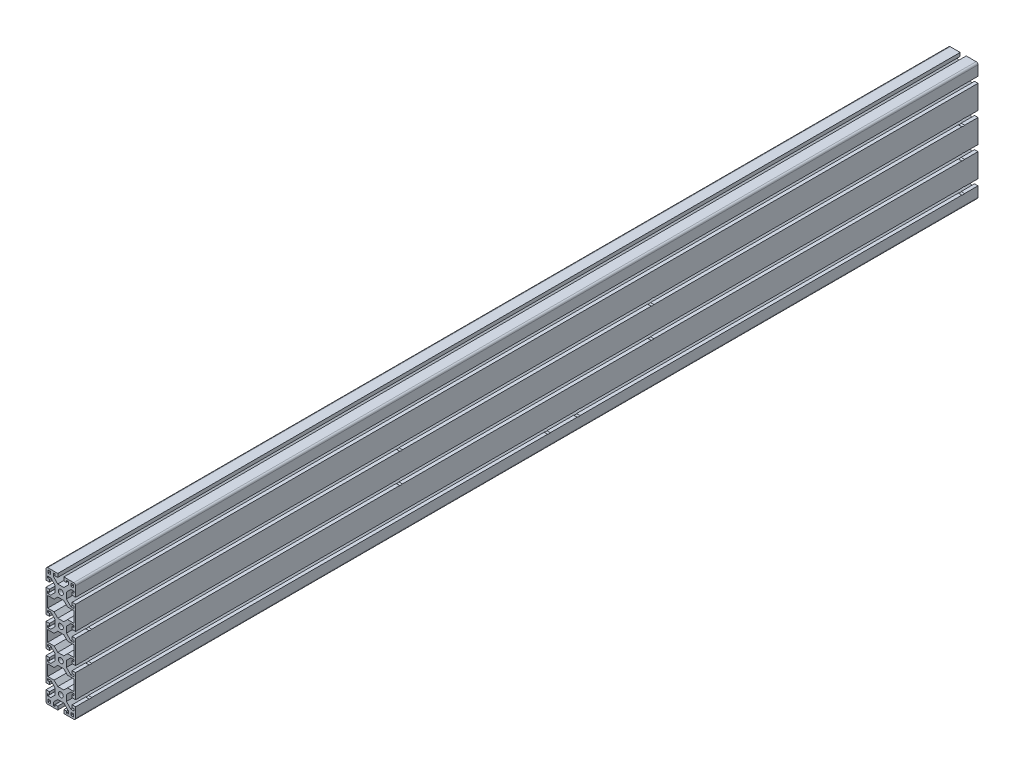
from build123d import *

# Parameters (mm, degrees)
SKETCH2_R                      = 3.35
SKETCH2_W                      = 3.788885221
SKETCH2_H                      = 3.788885221
F_40_SERIES_TS40_160LM_1_DEPTH = 1219.999999924
M8_CLEARANCE_HOLE1_D           = 9
M8_CLEARANCE_HOLE2_D           = 9
M8X1_25_TAPPED_HOLE2_D         = 6.8
M8X1_25_TAPPED_HOLE2_DEPTH     = 23.75
M8X1_25_TAPPED_HOLE2_TIP       = 2.042926105
M8X1_25_TAPPED_HOLE3_D         = 6.8
M8X1_25_TAPPED_HOLE3_DEPTH     = 23.75
M8X1_25_TAPPED_HOLE3_TIP       = 2.042926105


with BuildPart() as part:
    # Sketch2 → 40 series TS40-160LM(1) (new body)
    with BuildSketch(Plane.XY.offset(-609.999999962)):
        with BuildLine():
            Line((20, -15.9), (20, 15.9))
            Line((20, 15.9), (15.3, 15.9))
            Line((15.3, 15.9), (15.3, 12.4))
            Line((15.3, 12.4), (17.65, 12.4))
            Line((17.65, 12.4), (17.65, 9.9))
            Line((17.65, 9.9), (13.6, 9.9))
            Line((13.6, 9.9), (7.6, 15.9))
            Line((7.6, 15.9), (7.6, 24.1))
            Line((7.6, 24.1), (13.6, 30.1))
            Line((13.6, 30.1), (17.65, 30.1))
            Line((17.65, 30.1), (17.65, 27.6))
            Line((17.65, 27.6), (15.3, 27.6))
            Line((15.3, 27.6), (15.3, 24.1))
            Line((15.3, 24.1), (20, 24.1))
            Line((20, 24.1), (20, 55.9))
            Line((20, 55.9), (15.3, 55.9))
            Line((15.3, 55.9), (15.3, 52.4))
            Line((15.3, 52.4), (17.65, 52.4))
            Line((17.65, 52.4), (17.65, 49.9))
            Line((17.65, 49.9), (13.6, 49.9))
            Line((13.6, 49.9), (7.6, 55.9))
            Line((7.6, 55.9), (7.6, 64.1))
            Line((7.6, 64.1), (13.6, 70.1))
            Line((13.6, 70.1), (17.65, 70.1))
            Line((17.65, 70.1), (17.65, 67.6))
            Line((17.65, 67.6), (15.3, 67.6))
            Line((15.3, 67.6), (15.3, 64.1))
            Line((15.3, 64.1), (20, 64.1))
            Line((20, 64.1), (20, 77.5))
            ThreePointArc((20, 77.5), (19.267766953, 79.267766953), (17.5, 80))
            Line((17.5, 80), (4.1, 80))
            Line((4.1, 80), (4.1, 75.3))
            Line((4.1, 75.3), (7.6, 75.3))
            Line((7.6, 75.3), (7.6, 77.65))
            Line((7.6, 77.65), (10.1, 77.65))
            Line((10.1, 77.65), (10.1, 73.6))
            Line((10.1, 73.6), (4.1, 67.6))
            Line((4.1, 67.6), (-4.1, 67.6))
            Line((-4.1, 67.6), (-10.1, 73.6))
            Line((-10.1, 73.6), (-10.1, 77.65))
            Line((-10.1, 77.65), (-7.6, 77.65))
            Line((-7.6, 77.65), (-7.6, 75.3))
            Line((-7.6, 75.3), (-4.1, 75.3))
            Line((-4.1, 75.3), (-4.1, 80))
            Line((-4.1, 80), (-17.5, 80))
            ThreePointArc((-17.5, 80), (-19.267766953, 79.267766953), (-20, 77.5))
            Line((-20, 77.5), (-20, 64.1))
            Line((-20, 64.1), (-15.3, 64.1))
            Line((-15.3, 64.1), (-15.3, 67.6))
            Line((-15.3, 67.6), (-17.65, 67.6))
            Line((-17.65, 67.6), (-17.65, 70.1))
            Line((-17.65, 70.1), (-13.6, 70.1))
            Line((-13.6, 70.1), (-7.6, 64.1))
            Line((-7.6, 64.1), (-7.6, 55.9))
            Line((-7.6, 55.9), (-13.6, 49.9))
            Line((-13.6, 49.9), (-17.65, 49.9))
            Line((-17.65, 49.9), (-17.65, 52.4))
            Line((-17.65, 52.4), (-15.3, 52.4))
            Line((-15.3, 52.4), (-15.3, 55.9))
            Line((-15.3, 55.9), (-20, 55.9))
            Line((-20, 55.9), (-20, 24.1))
            Line((-20, 24.1), (-15.3, 24.1))
            Line((-15.3, 24.1), (-15.3, 27.6))
            Line((-15.3, 27.6), (-17.65, 27.6))
            Line((-17.65, 27.6), (-17.65, 30.1))
            Line((-17.65, 30.1), (-13.6, 30.1))
            Line((-13.6, 30.1), (-7.6, 24.1))
            Line((-7.6, 24.1), (-7.6, 15.9))
            Line((-7.6, 15.9), (-13.6, 9.9))
            Line((-13.6, 9.9), (-17.65, 9.9))
            Line((-17.65, 9.9), (-17.65, 12.4))
            Line((-17.65, 12.4), (-15.3, 12.4))
            Line((-15.3, 12.4), (-15.3, 15.9))
            Line((-15.3, 15.9), (-20, 15.9))
            Line((-20, 15.9), (-20, -15.9))
            Line((-20, -15.9), (-15.3, -15.9))
            Line((-15.3, -15.9), (-15.3, -12.4))
            Line((-15.3, -12.4), (-17.65, -12.4))
            Line((-17.65, -12.4), (-17.65, -9.9))
            Line((-17.65, -9.9), (-13.6, -9.9))
            Line((-13.6, -9.9), (-7.6, -15.9))
            Line((-7.6, -15.9), (-7.6, -24.1))
            Line((-7.6, -24.1), (-13.6, -30.1))
            Line((-13.6, -30.1), (-17.65, -30.1))
            Line((-17.65, -30.1), (-17.65, -27.6))
            Line((-17.65, -27.6), (-15.3, -27.6))
            Line((-15.3, -27.6), (-15.3, -24.1))
            Line((-15.3, -24.1), (-20, -24.1))
            Line((-20, -24.1), (-20, -55.9))
            Line((-20, -55.9), (-15.3, -55.9))
            Line((-15.3, -55.9), (-15.3, -52.4))
            Line((-15.3, -52.4), (-17.65, -52.4))
            Line((-17.65, -52.4), (-17.65, -49.9))
            Line((-17.65, -49.9), (-13.6, -49.9))
            Line((-13.6, -49.9), (-7.6, -55.9))
            Line((-7.6, -55.9), (-7.6, -64.1))
            Line((-7.6, -64.1), (-13.6, -70.1))
            Line((-13.6, -70.1), (-17.65, -70.1))
            Line((-17.65, -70.1), (-17.65, -67.6))
            Line((-17.65, -67.6), (-15.3, -67.6))
            Line((-15.3, -67.6), (-15.3, -64.1))
            Line((-15.3, -64.1), (-20, -64.1))
            Line((-20, -64.1), (-20, -77.5))
            ThreePointArc((-20, -77.5), (-19.267766953, -79.267766953), (-17.5, -80))
            Line((-17.5, -80), (-4.1, -80))
            Line((-4.1, -80), (-4.1, -75.3))
            Line((-4.1, -75.3), (-7.6, -75.3))
            Line((-7.6, -75.3), (-7.6, -77.65))
            Line((-7.6, -77.65), (-10.1, -77.65))
            Line((-10.1, -77.65), (-10.1, -73.6))
            Line((-10.1, -73.6), (-4.1, -67.6))
            Line((-4.1, -67.6), (4.1, -67.6))
            Line((4.1, -67.6), (10.1, -73.6))
            Line((10.1, -73.6), (10.1, -77.65))
            Line((10.1, -77.65), (7.6, -77.65))
            Line((7.6, -77.65), (7.6, -75.3))
            Line((7.6, -75.3), (4.1, -75.3))
            Line((4.1, -75.3), (4.1, -80))
            Line((4.1, -80), (17.5, -80))
            ThreePointArc((17.5, -80), (19.267766953, -79.267766953), (20, -77.5))
            Line((20, -77.5), (20, -64.1))
            Line((20, -64.1), (15.3, -64.1))
            Line((15.3, -64.1), (15.3, -67.6))
            Line((15.3, -67.6), (17.65, -67.6))
            Line((17.65, -67.6), (17.65, -70.1))
            Line((17.65, -70.1), (13.6, -70.1))
            Line((13.6, -70.1), (7.6, -64.1))
            Line((7.6, -64.1), (7.6, -55.9))
            Line((7.6, -55.9), (13.6, -49.9))
            Line((13.6, -49.9), (17.65, -49.9))
            Line((17.65, -49.9), (17.65, -52.4))
            Line((17.65, -52.4), (15.3, -52.4))
            Line((15.3, -52.4), (15.3, -55.9))
            Line((15.3, -55.9), (20, -55.9))
            Line((20, -55.9), (20, -24.1))
            Line((20, -24.1), (15.3, -24.1))
            Line((15.3, -24.1), (15.3, -27.6))
            Line((15.3, -27.6), (17.65, -27.6))
            Line((17.65, -27.6), (17.65, -30.1))
            Line((17.65, -30.1), (13.6, -30.1))
            Line((13.6, -30.1), (7.6, -24.1))
            Line((7.6, -24.1), (7.6, -15.9))
            Line((7.6, -15.9), (13.6, -9.9))
            Line((13.6, -9.9), (17.65, -9.9))
            Line((17.65, -9.9), (17.65, -12.4))
            Line((17.65, -12.4), (15.3, -12.4))
            Line((15.3, -12.4), (15.3, -15.9))
            Line((15.3, -15.9), (20, -15.9))
        make_face()
        with Locations((0, 20)):
            Circle(SKETCH2_R, mode=Mode.SUBTRACT)
        with Locations((0, -20)):
            Circle(SKETCH2_R, mode=Mode.SUBTRACT)
        Polygon((-4.063201324, 12.4), (4.063201324, 12.4), (9.063201324, 7.4), (17.65, 7.4), (17.65, -7.4), (9.063201324, -7.4), (4.063201324, -12.4), (-4.063201324, -12.4), (-9.063201324, -7.4), (-17.65, -7.4), (-17.65, 7.4), (-9.063201324, 7.4), align=None, mode=Mode.SUBTRACT)
        Polygon((17.65, 32.6), (17.65, 47.4), (9.063201324, 47.4), (4.063201324, 52.4), (-4.063201324, 52.4), (-9.063201324, 47.4), (-17.65, 47.4), (-17.65, 32.6), (-9.063201324, 32.6), (-4.063201324, 27.6), (4.063201324, 27.6), (9.063201324, 32.6), align=None, mode=Mode.SUBTRACT)
        with Locations((15.605557389, 75.60555739)):
            Rectangle(SKETCH2_W, SKETCH2_H, mode=Mode.SUBTRACT)
        with Locations((-15.605557389, 75.60555739)):
            Rectangle(SKETCH2_W, SKETCH2_H, mode=Mode.SUBTRACT)
        Polygon((-17.65, -32.6), (-17.65, -47.4), (-9.063201324, -47.4), (-4.063201324, -52.4), (4.063201324, -52.4), (9.063201324, -47.4), (17.65, -47.4), (17.65, -32.6), (9.063201324, -32.6), (4.063201324, -27.6), (-4.063201324, -27.6), (-9.063201324, -32.6), align=None, mode=Mode.SUBTRACT)
        with Locations((-15.605557389, -75.60555739)):
            Rectangle(SKETCH2_W, SKETCH2_H, mode=Mode.SUBTRACT)
        with Locations((15.605557389, -75.60555739)):
            Rectangle(SKETCH2_W, SKETCH2_H, mode=Mode.SUBTRACT)
        with BuildLine():
            ThreePointArc((0, 56.65), (3.35, 60), (0, 63.35))
            ThreePointArc((0, 63.35), (-3.35, 60), (0, 56.65))
        make_face(mode=Mode.SUBTRACT)
        with BuildLine():
            ThreePointArc((0, -56.65), (-3.35, -60), (0, -63.35))
            ThreePointArc((0, -63.35), (3.35, -60), (0, -56.65))
        make_face(mode=Mode.SUBTRACT)
    extrude(amount=F_40_SERIES_TS40_160LM_1_DEPTH)

    # M8 Clearance Hole1 (through all)
    with Locations(Plane(origin=(20, 0, 0), x_dir=(0, 0, -1), z_dir=(1, 0, 0))):
        with Locations((-589.999999962, 20), (589.999999962, -20), (-589.999999962, -20), (589.999999962, 20), (-170, 20), (-170, -20), (170, 20), (170, -20), (-589.999999962, -60), (589.999999962, -60)):
            Hole(M8_CLEARANCE_HOLE1_D / 2)

    # M8 Clearance Hole2 (through all)
    with Locations(Plane(origin=(20, 0, 0), x_dir=(0, 0, -1), z_dir=(1, 0, 0))):
        with Locations((30, -60), (70, -60)):
            Hole(M8_CLEARANCE_HOLE2_D / 2)

    # M8x1.25 Tapped Hole2
    with Locations(Plane.XY.offset(609.999999962)):
        with Locations((0, 60), (0, 20), (0, -20)):
            Hole(M8X1_25_TAPPED_HOLE2_D / 2, depth=M8X1_25_TAPPED_HOLE2_DEPTH)
            with Locations((0, 0, -(M8X1_25_TAPPED_HOLE2_DEPTH + M8X1_25_TAPPED_HOLE2_TIP / 2))):  # 118° drill point
                Cone(0, M8X1_25_TAPPED_HOLE2_D / 2, M8X1_25_TAPPED_HOLE2_TIP, mode=Mode.SUBTRACT)

    # M8x1.25 Tapped Hole3
    with Locations(Plane(origin=(0, 0, -609.999999962), x_dir=(-1, 0, 0), z_dir=(0, 0, -1))):
        with Locations((0, 60), (0, 20), (0, -20), (0, -60)):
            Hole(M8X1_25_TAPPED_HOLE3_D / 2, depth=M8X1_25_TAPPED_HOLE3_DEPTH)
            with Locations((0, 0, -(M8X1_25_TAPPED_HOLE3_DEPTH + M8X1_25_TAPPED_HOLE3_TIP / 2))):  # 118° drill point
                Cone(0, M8X1_25_TAPPED_HOLE3_D / 2, M8X1_25_TAPPED_HOLE3_TIP, mode=Mode.SUBTRACT)


solid = part.part
